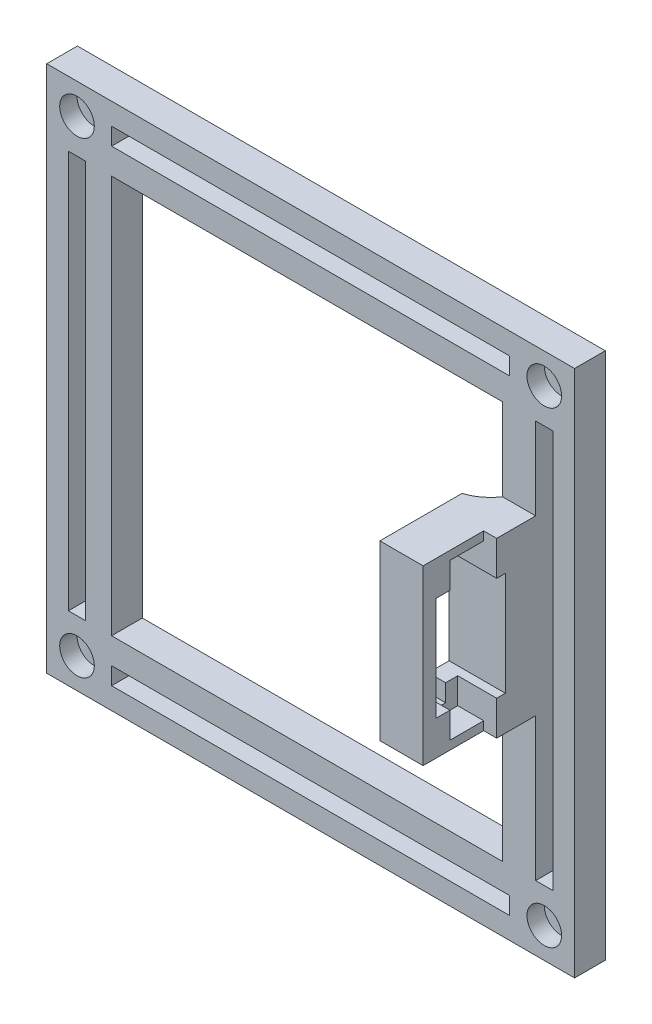
from build123d import *

# Parameters (mm, degrees)
SKETCH_1_W          = 104
SKETCH_1_H          = 104
SKETCH_1_W_2        = 92
SKETCH_1_H_2        = 92
EXTRUDE_1_DEPTH     = 7.1
SKETCH_2_W          = 6
SKETCH_2_H          = 40
EXTRUDE_2_DEPTH     = 7
SKETCH_3_W          = 6
SKETCH_3_H          = 8
EXTRUDE_3_DEPTH     = 13
SKETCH_4_W          = 6
SKETCH_4_H          = 40
EXTRUDE_4_DEPTH     = 3
SKETCH_5_W          = 3
SKETCH_5_H          = 14
CUT_EXTRUDE_1_DEPTH = 118.383985279
SKETCH_6_W          = 19
SKETCH_6_H          = 40
SKETCH_6_W_2        = 13
SKETCH_6_H_2        = 24
EXTRUDE_5_DEPTH     = 7
SKETCH_7_W          = 3
SKETCH_7_H          = 4
CUT_EXTRUDE_3_DEPTH = 134.547744271
SKETCH_8_W          = 7.8
SKETCH_8_H          = 6
CUT_EXTRUDE_4_DEPTH = 6
FILLET_START        = 30
FILLET_1_DEPTH      = 40
FILLET_START_2      = -4
FILLET_1_2_DEPTH    = 94
SKETCH_9_W          = 10
SKETCH_9_H          = 10
EXTRUDE_6_DEPTH     = 7.1
SKETCH_10_W         = 122
SKETCH_10_H         = 122
SKETCH_10_W_2       = 112
SKETCH_10_H_2       = 112
EXTRUDE_7_DEPTH     = 7.1
SKETCH_11_R         = 1.5
CUT_EXTRUDE_5_DEPTH = 149.865711297
SKETCH_12_R         = 4
CUT_EXTRUDE_6_DEPTH = 4


with BuildPart() as part:
    # 草图1 → 凸台-拉伸1 (new body)
    with BuildSketch(Plane.XY):
        with Locations((43, 43)):
            Rectangle(SKETCH_1_W, SKETCH_1_H)
        with Locations((43, 43)):
            Rectangle(SKETCH_1_W_2, SKETCH_1_H_2, mode=Mode.SUBTRACT)
    extrude(amount=-EXTRUDE_1_DEPTH)

    # 草图2 → 凸台-拉伸2 (add)
    with BuildSketch(Plane.XY):
        with Locations((92, 50)):
            Rectangle(SKETCH_2_W, SKETCH_2_H)
    extrude(amount=EXTRUDE_2_DEPTH)

    # 草图3 → 凸台-拉伸3 (add)
    with BuildSketch(Plane.XY.offset(7)):
        with Locations((92, 66)):
            Rectangle(SKETCH_3_W, SKETCH_3_H)
        with Locations((92, 34)):
            Rectangle(SKETCH_3_W, SKETCH_3_H)
    extrude(amount=EXTRUDE_3_DEPTH)

    # 草图4 → 凸台-拉伸4 (add)
    with BuildSketch(Plane.XY.offset(20)):
        with Locations((92, 50)):
            Rectangle(SKETCH_4_W, SKETCH_4_H)
    extrude(amount=EXTRUDE_4_DEPTH)

    # 草图5 → 切除-拉伸1 (cut, through all)
    with BuildSketch(Plane.XZ.offset(-30)):
        with Locations((93.5, 16)):
            Rectangle(SKETCH_5_W, SKETCH_5_H)
    extrude(amount=-CUT_EXTRUDE_1_DEPTH, mode=Mode.SUBTRACT)

    # 草图6 → 凸台-拉伸5 (add)
    with BuildSketch(Plane.ZY.offset(-89)):
        with Locations((13.5, 50)):
            Rectangle(SKETCH_6_W, SKETCH_6_H)
        with Locations((13.5, 50)):
            Rectangle(SKETCH_6_W_2, SKETCH_6_H_2, mode=Mode.SUBTRACT)
    extrude(amount=EXTRUDE_5_DEPTH)

    # 草图7 → 切除-拉伸3 (cut, through all)
    with BuildSketch(Plane.ZY.offset(-82)):
        with Locations((13.3, 64)):
            Rectangle(SKETCH_7_W, SKETCH_7_H)
        with Locations((13.3, 36)):
            Rectangle(SKETCH_7_W, SKETCH_7_H)
    extrude(amount=-CUT_EXTRUDE_3_DEPTH, mode=Mode.SUBTRACT)

    # 草图8 → 切除-拉伸4 (cut)
    with BuildSketch(Plane(origin=(92, 0, 0), x_dir=(0, 0, -1), z_dir=(1, 0, 0))):
        with Locations((-12.9, 65)):
            Rectangle(SKETCH_8_W, SKETCH_8_H)
        with Locations((-12.9, 35)):
            Rectangle(SKETCH_8_W, SKETCH_8_H)
    extrude(amount=-CUT_EXTRUDE_4_DEPTH, mode=Mode.SUBTRACT)

    # 圆角1: read off the stored shape, not the designer's step
    # 圆角1 outline → 圆角1 (add)
    with BuildSketch(Plane(origin=(0, 0, 0), x_dir=(1, 0, 0), z_dir=(0, 1, 0)).offset(FILLET_START)):
        with BuildLine():
            ThreePointArc((89, 5.539392014), (87.062257748, -0.376687769), (82, -4))
            Line((82, -4), (89, -4))
            Line((89, -4), (89, 5.539392014))
        make_face()
    extrude(amount=FILLET_1_DEPTH)

    # Fillet 1 2 outline → Fillet 1 2 (add)
    with BuildSketch(Plane(origin=(0, 0, 0), x_dir=(1, 0, 0), z_dir=(0, 1, 0)).offset(FILLET_START_2)):
        with BuildLine():
            Line((89, 0), (89, 5.539392014))
            ThreePointArc((89, 5.539392014), (88.572244047, 2.645926288), (87.325571218, 0))
            Line((87.325571218, 0), (89, 0))
        make_face()
    extrude(amount=FILLET_1_2_DEPTH)

    # 草图9 → 凸台-拉伸6 (add)
    with BuildSketch(Plane(origin=(0, 0, -7.1), x_dir=(-1, 0, 0), z_dir=(0, 0, -1))):
        with Locations((8, -8)):
            Rectangle(SKETCH_9_W, SKETCH_9_H)
        with Locations((-94, -8)):
            Rectangle(SKETCH_9_W, SKETCH_9_H)
        with Locations((8, 94)):
            Rectangle(SKETCH_9_W, SKETCH_9_H)
        with Locations((-94, 94)):
            Rectangle(SKETCH_9_W, SKETCH_9_H)
    extrude(amount=-EXTRUDE_6_DEPTH)

    # 草图10 → 凸台-拉伸7 (add)
    with BuildSketch(Plane(origin=(0, 0, -7.1), x_dir=(-1, 0, 0), z_dir=(0, 0, -1))):
        with Locations((-43, 43)):
            Rectangle(SKETCH_10_W, SKETCH_10_H)
        with Locations((-43, 43)):
            Rectangle(SKETCH_10_W_2, SKETCH_10_H_2, mode=Mode.SUBTRACT)
    extrude(amount=-EXTRUDE_7_DEPTH)

    # 草图11 → 切除-拉伸5 (cut, through all)
    with BuildSketch(Plane.XY):
        with Locations((-11, 97)):
            Circle(SKETCH_11_R)
        with Locations((-11, -11)):
            Circle(SKETCH_11_R)
        with Locations((97, 97)):
            Circle(SKETCH_11_R)
        with Locations((97, -11)):
            Circle(SKETCH_11_R)
    extrude(amount=-CUT_EXTRUDE_5_DEPTH, mode=Mode.SUBTRACT)

    # 草图12 → 切除-拉伸6 (cut)
    with BuildSketch(Plane.XY):
        with Locations((-11, 97)):
            Circle(SKETCH_12_R)
        with Locations((97, 97)):
            Circle(SKETCH_12_R)
        with Locations((-11, -11)):
            Circle(SKETCH_12_R)
        with Locations((97, -11)):
            Circle(SKETCH_12_R)
    extrude(amount=-CUT_EXTRUDE_6_DEPTH, mode=Mode.SUBTRACT)


solid = part.part
